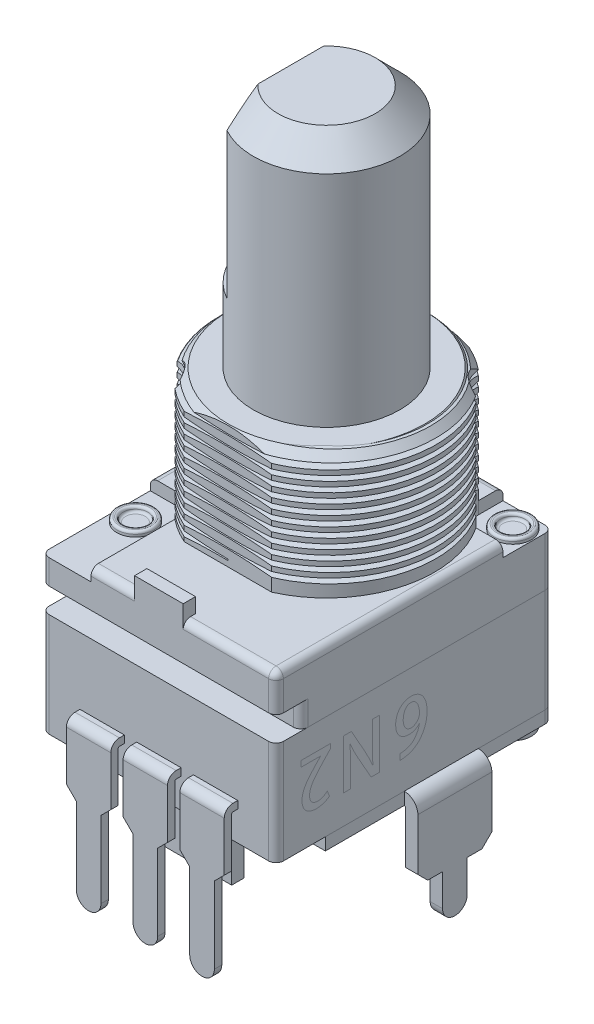
from build123d import *

# Parameters (mm, degrees)
SKETCH1_W               = 9.5
SKETCH1_H               = 11.2
BOSS_EXTRUDE1_DEPTH     = 7.2
SKETCH2_R               = 4.375
BOSS_EXTRUDE2_DEPTH     = 5
SKETCH3_R               = 2.97
BOSS_EXTRUDE3_DEPTH     = 9.9
CHAMFER1_SIZE           = 1
CUT_EXTRUDE1_START      = -6.9
CUT_EXTRUDE1_DEPTH      = 6.9
SKETCH5_W               = 1.8
SKETCH5_H               = 0.3
BOSS_EXTRUDE5_DEPTH     = 0.2
SKETCH7_W               = 1.8
SKETCH7_H               = 0.3
SKETCH8_W               = 1.8
SKETCH8_H               = 0.3
BOSS_EXTRUDE6_DEPTH     = 2
SKETCH9_W               = 1
SKETCH9_H               = 0.3
BOSS_EXTRUDE7_DEPTH     = 4
SKETCH10_W              = 3
SKETCH10_H              = 0.5
SKETCH12_W              = 0.5
SKETCH12_H              = 3
BOSS_EXTRUDE8_DEPTH     = 2.5
SKETCH14_W              = 0.5
SKETCH14_H              = 1
BOSS_EXTRUDE9_DEPTH     = 1.8
SKETCH15_W              = 3
SKETCH15_H              = 0.5
FILLET1_R               = 0.5
CHAMFER2_SIZE           = 0.4
SKETCH17_W              = 3
SKETCH17_H              = 0.5
BOSS_EXTRUDE10_DEPTH    = 2.5
SKETCH18_W              = 9.5
SKETCH18_H              = 0.5
CUT_EXTRUDE2_DEPTH      = 2
SKETCH20_W              = 9.5
SKETCH20_H              = 1
CUT_EXTRUDE3_DEPTH      = 1
SKETCH22_W              = 1.97
SKETCH22_H              = 0.5
BOSS_EXTRUDE11_DEPTH    = 0.6
CHAMFER4_SIZE           = 0.4
CUT_EXTRUDE4_DEPTH      = 17.968279229
CUT_EXTRUDE4_DEPTH_BACK = 0.5
SKETCH24_W              = 9.5
SKETCH24_H              = 0.4
CUT_EXTRUDE5_DEPTH      = 17.968279229
SKETCH25_R              = 0.75
SKETCH25_R_2            = 0.5
BOSS_EXTRUDE12_DEPTH    = 0.2
FILLET2_R               = 0.1
BOSS_EXTRUDE13_START    = 0.2
SKETCH27_R              = 0.75
BOSS_EXTRUDE13_DEPTH    = 0.2
FILLET3_R               = 0.3
CUT_SWEEP9_PITCH        = 0.4


with BuildPart() as part:
    # Sketch1 → Boss-Extrude1 (new body)
    with BuildSketch(Plane(origin=(0, 0, 0), x_dir=(1, 0, 0), z_dir=(0, 1, 0))):
        Rectangle(SKETCH1_W, SKETCH1_H)
    extrude(amount=BOSS_EXTRUDE1_DEPTH)

    # Sketch2 → Boss-Extrude2 (add)
    with BuildSketch(Plane(origin=(0, 7.2, 0), x_dir=(1, 0, 0), z_dir=(0, 1, 0))):
        with Locations(Location((0, 1.2, 0), (0, 0, 270))):
            Circle(SKETCH2_R)
    extrude(amount=BOSS_EXTRUDE2_DEPTH)

    # Sketch3 → Boss-Extrude3 (add)
    with BuildSketch(Plane(origin=(0, 12.2, 0), x_dir=(1, 0, 0), z_dir=(0, 1, 0))):
        with Locations(Location((0, 1.2, 0), (0, 0, 90))):
            Circle(SKETCH3_R)
    extrude(amount=BOSS_EXTRUDE3_DEPTH)

    # Chamfer1
    chamfer1_edges = [part.edges().sort_by_distance(p)[0] for p in [
        (0, 22.1, 1.77),
    ]]
    chamfer(chamfer1_edges, length=CHAMFER1_SIZE)

    # Sketch4 → Cut-Extrude1 (cut)
    with BuildSketch(Plane(origin=(0, 22.1, 0), x_dir=(1, 0, 0), z_dir=(0, 1, 0)).offset(CUT_EXTRUDE1_START)):
        with BuildLine():
            Line((-1.45, 3.791987654), (-1.45, -1.391987654))
            ThreePointArc((-1.45, -1.391987654), (-2.97, 1.2), (-1.45, 3.791987654))
        make_face()
    extrude(amount=CUT_EXTRUDE1_DEPTH, mode=Mode.SUBTRACT)

    # Sketch5 → Boss-Extrude5 (add)
    with BuildSketch(Plane.XY.offset(5.6)):
        with Locations((-2.3, 1.85)):
            Rectangle(SKETCH5_W, SKETCH5_H)
        with Locations((0, 1.85)):
            Rectangle(SKETCH5_W, SKETCH5_H)
        with Locations((2.3, 1.85)):
            Rectangle(SKETCH5_W, SKETCH5_H)
    extrude(amount=BOSS_EXTRUDE5_DEPTH)

    # Sweep1: sweep along a path in Sketch6
    with BuildLine(Plane(origin=(0, 0, 0), x_dir=(0, 0, -1), z_dir=(1, 0, 0))) as sweep1_path:
        ThreePointArc((-5.8, 1.7), (-5.835355339, 1.685355339), (-5.85, 1.65))
    # Sketch7 → Sweep1 (sweep)
    with BuildSketch(Plane.XY.offset(5.8)):
        with Locations((-2.3, 1.85)):
            Rectangle(SKETCH7_W, SKETCH7_H)
        with Locations((0, 1.85)):
            Rectangle(SKETCH7_W, SKETCH7_H)
        with Locations((2.3, 1.85)):
            Rectangle(SKETCH7_W, SKETCH7_H)
    sweep(path=sweep1_path.line)

    # Sketch8 → Boss-Extrude6 (add)
    with BuildSketch(Plane.XZ.offset(-1.65)):
        with Locations((-2.3, 6)):
            Rectangle(SKETCH8_W, SKETCH8_H)
        with Locations((0, 6)):
            Rectangle(SKETCH8_W, SKETCH8_H)
        with Locations((2.3, 6)):
            Rectangle(SKETCH8_W, SKETCH8_H)
    extrude(amount=BOSS_EXTRUDE6_DEPTH)

    # Sketch9 → Boss-Extrude7 (add)
    with BuildSketch(Plane.XZ.offset(0.35)):
        with Locations((-2.3, 6)):
            Rectangle(SKETCH9_W, SKETCH9_H)
        with Locations((0, 6)):
            Rectangle(SKETCH9_W, SKETCH9_H)
        with Locations((2.3, 6)):
            Rectangle(SKETCH9_W, SKETCH9_H)
    extrude(amount=BOSS_EXTRUDE7_DEPTH)

    # Sweep2: sweep along a path in Sketch11
    with BuildLine(Plane.XY) as sweep2_path:
        ThreePointArc((-4.75, 0), (-4.785355339, -0.014644661), (-4.8, -0.05))
    # Sketch10 → Sweep2 (sweep)
    with BuildSketch(Plane.ZY.offset(4.75)):
        with Locations((-1.1, 0.25)):
            Rectangle(SKETCH10_W, SKETCH10_H)
    sweep2 = sweep(path=sweep2_path.line)

    # Sketch12 → Boss-Extrude8 (add)
    with BuildSketch(Plane.XZ.offset(0.05)):
        with Locations((-5.05, -1.1)):
            Rectangle(SKETCH12_W, SKETCH12_H)
    boss_extrude8 = extrude(amount=BOSS_EXTRUDE8_DEPTH)

    # Sketch14 → Boss-Extrude9 (add)
    with BuildSketch(Plane.XZ.offset(2.55)):
        with Locations((-5.05, -1.1)):
            Rectangle(SKETCH14_W, SKETCH14_H)
    boss_extrude9 = extrude(amount=BOSS_EXTRUDE9_DEPTH)

    # Mirror1: Sweep2, Boss-Extrude8, Boss-Extrude9 across plane
    add(sweep2.mirror(Plane(origin=(0, 0, 0), x_dir=(0, 0, 1), z_dir=(1, 0, 0))))
    add(boss_extrude8.mirror(Plane(origin=(0, 0, 0), x_dir=(0, 0, 1), z_dir=(1, 0, 0))))
    add(boss_extrude9.mirror(Plane(origin=(0, 0, 0), x_dir=(0, 0, 1), z_dir=(1, 0, 0))))

    # Sweep3: sweep along a path in Sketch16
    with BuildLine(Plane(origin=(0, 0, 0), x_dir=(0, 0, -1), z_dir=(1, 0, 0))) as sweep3_path:
        ThreePointArc((5.65, -0.05), (5.635355339, -0.014644661), (5.6, 0))
    # Sketch15 → Sweep3 (sweep)
    with BuildSketch(Plane(origin=(0, 0, -5.6), x_dir=(-1, 0, 0), z_dir=(0, 0, -1))):
        with Locations((0, 0.25)):
            Rectangle(SKETCH15_W, SKETCH15_H)
    sweep3 = sweep(path=sweep3_path.line)

    # Fillet1
    fillet1_edges = [part.edges().sort_by_distance(p)[0] for p in [
        (2.8, -4.35, 6),
        (1.8, -4.35, 6),
        (0.5, -4.35, 6),
        (-0.5, -4.35, 6),
        (-1.8, -4.35, 6),
        (-2.8, -4.35, 6),
        (-5.05, -4.35, -0.6),
        (-5.05, -4.35, -1.6),
        (5.05, -4.35, -0.6),
        (5.05, -4.35, -1.6),
    ]]
    fillet(fillet1_edges, radius=FILLET1_R - 0.0001)  # a hair under: the kernel refuses the full size

    # Chamfer2
    chamfer2_edges = [part.edges().sort_by_distance(p)[0] for p in [
        (1.8, -0.35, 6),
        (2.8, -0.35, 6),
        (0.5, -0.35, 6),
        (-0.5, -0.35, 6),
        (-1.8, -0.35, 6),
        (-2.8, -0.35, 6),
        (-5.05, -2.55, 0.4),
        (-5.05, -2.55, -2.6),
        (5.05, -2.55, -2.6),
        (5.05, -2.55, 0.4),
    ]]
    chamfer(chamfer2_edges, length=CHAMFER2_SIZE - 0.0001)  # a hair under: the kernel refuses the full size

    # Sketch17 → Boss-Extrude10 (add)
    with BuildSketch(Plane.XZ.offset(0.05)):
        with Locations((0, -5.9)):
            Rectangle(SKETCH17_W, SKETCH17_H)
    boss_extrude10 = extrude(amount=BOSS_EXTRUDE10_DEPTH)

    # Sketch18 → Cut-Extrude2 (cut)
    with BuildSketch(Plane.XY.offset(5.6)):
        with Locations((0, 0.25)):
            Rectangle(SKETCH18_W, SKETCH18_H)
    extrude(amount=-CUT_EXTRUDE2_DEPTH, mode=Mode.SUBTRACT)

    # Mirror2: Sweep3, Boss-Extrude10 across plane
    add(sweep3.mirror(Plane.XY.offset(-1)))
    add(boss_extrude10.mirror(Plane.XY.offset(-1)))

    # Sketch20 → Cut-Extrude3 (cut)
    with BuildSketch(Plane.XY.offset(5.6)):
        with Locations((0, 5.2)):
            Rectangle(SKETCH20_W, SKETCH20_H)
    extrude(amount=-CUT_EXTRUDE3_DEPTH, mode=Mode.SUBTRACT)

    # Sketch22 → Boss-Extrude11 (add)
    with BuildSketch(Plane(origin=(0, 7.2, 0), x_dir=(1, 0, 0), z_dir=(0, 1, 0))):
        with Locations((0, -5.35)):
            Rectangle(SKETCH22_W, SKETCH22_H)
    extrude(amount=BOSS_EXTRUDE11_DEPTH)

    # Chamfer4
    chamfer4_edges = [part.edges().sort_by_distance(p)[0] for p in [
        (0, 12.2, -5.575),
    ]]
    chamfer(chamfer4_edges, length=CHAMFER4_SIZE)

    # Sketch23 → Cut-Extrude4 (cut, two sides: drawn at the far end of the back side and taken through both)
    with BuildSketch(Plane(origin=(0, 7.2, 0), x_dir=(1, 0, 0), z_dir=(0, 1, 0)).offset(-CUT_EXTRUDE4_DEPTH_BACK)):
        with BuildLine():
            Line((4.75, 5.6), (2.75, 5.6))
            Line((2.75, 5.6), (2.75, 4.6))
            ThreePointArc((2.75, 4.6), (3.042893219, 3.892893219), (3.75, 3.6))
            Line((3.75, 3.6), (4.75, 3.6))
            Line((4.75, 3.6), (4.75, 5.6))
        make_face()
        with BuildLine():
            Line((-4.75, -5.6), (-2.75, -5.6))
            Line((-2.75, -5.6), (-2.75, -2.2))
            ThreePointArc((-2.75, -2.2), (-3.042893219, -1.492893219), (-3.75, -1.2))
            Line((-3.75, -1.2), (-4.75, -1.2))
            Line((-4.75, -1.2), (-4.75, -5.6))
        make_face()
    extrude(amount=CUT_EXTRUDE4_DEPTH + CUT_EXTRUDE4_DEPTH_BACK, mode=Mode.SUBTRACT)

    # Sketch24 → Cut-Extrude5 (cut, through all)
    with BuildSketch(Plane(origin=(0, 7.2, 0), x_dir=(1, 0, 0), z_dir=(0, 1, 0))):
        with Locations((0, 5.4)):
            Rectangle(SKETCH24_W, SKETCH24_H)
        with Locations((0, -3)):
            Rectangle(SKETCH24_W, SKETCH24_H)
    extrude(amount=CUT_EXTRUDE5_DEPTH, mode=Mode.SUBTRACT)

    # Sketch25 → Boss-Extrude12 (add)
    # profile 1 of 2: a face of its own
    with BuildSketch(Plane(origin=(0, 6.7, 0), x_dir=(1, 0, 0), z_dir=(0, 1, 0))):
        with Locations(Location((3.95, 4.8, 0), (0, 0, 90))):
            Circle(SKETCH25_R)
        with Locations(Location((3.95, 4.8, 0), (0, 0, 270))):
            Circle(SKETCH25_R_2, mode=Mode.SUBTRACT)
    # profile 2 of 2: a face of its own
    with BuildSketch(Plane(origin=(0, 6.7, 0), x_dir=(1, 0, 0), z_dir=(0, 1, 0))):
        with Locations(Location((-3.95, -2.6, 0), (0, 0, 90))):
            Circle(SKETCH25_R)
        with Locations(Location((-3.95, -2.6, 0), (0, 0, 270))):
            Circle(SKETCH25_R_2, mode=Mode.SUBTRACT)
    extrude(amount=BOSS_EXTRUDE12_DEPTH)

    # Fillet2
    fillet2_edges = [part.edges().sort_by_distance(p)[0] for p in [
        (3.95, 6.9, -4.05),
        (3.95, 6.7, -5.3),
        (3.95, 6.9, -5.3),
        (-3.95, 6.9, 3.35),
        (-3.95, 6.7, 2.1),
        (-3.95, 6.9, 2.1),
    ]]
    fillet(fillet2_edges, radius=FILLET2_R - 0.0001)  # a hair under: the kernel refuses the full size

    # Sketch27 → Boss-Extrude13 (add)
    with BuildSketch(Plane.XZ.offset(BOSS_EXTRUDE13_START)):
        with Locations(Location((-3.95, 2.6, 0), (0, 0, 270))):
            Circle(SKETCH27_R)
        with Locations(Location((3.95, -4.8, 0), (0, 0, 270))):
            Circle(SKETCH27_R)
    extrude(amount=-BOSS_EXTRUDE13_DEPTH)

    # Fillet3
    fillet3_edges = [part.edges().sort_by_distance(p)[0] for p in [
        (4.75, 7.2, 1),
        (-4.75, 7.2, -2.2),
        (4.75, 3.35, -5.6),
        (-4.75, 3.6, -5.6),
        (4.75, 2.6, 5.6),
        (-4.75, 2.6, 5.6),
        (-4.75, 5.2, 4.6),
        (4.75, 5.2, 4.6),
        (4.75, 3.35, -5.6),
        (-4.75, 3.6, -5.6),
        (2.8675, 7.2, 5.6),
        (4.75, 3.35, -5.6),
        (-1, 7.2, -5.6),
        (-4.75, 6.2, 5.6),
        (-1.8675, 7.2, 5.6),
        (-4.75, 3.6, -5.6),
        (4.75, 6.45, 5.6),
    ]]
    fillet(fillet3_edges, radius=FILLET3_R)

    # Cut-Sweep9: arcs per turn and ends read off the stored shape
    # Cut-Sweep9: the profile of Sketch35 screwed along a left-hand helix through 14 turns, 6 arcs to a turn; built about Z, then put on its axis
    cut_sweep9_z = Axis((0, 0, 0), (0, 0, 1))
    cut_sweep9_corners = [(3.875, 0, 0), (4.975, 0, 0.225), (4.975, 0, -0.225)]
    with BuildLine(mode=Mode.PRIVATE) as cut_sweep9_profile:
        Line(cut_sweep9_corners[0], cut_sweep9_corners[1])
        Line(cut_sweep9_corners[1], cut_sweep9_corners[2])
        Line(cut_sweep9_corners[2], cut_sweep9_corners[0])
    cut_sweep9_cap = Face(cut_sweep9_profile.wire())
    cut_sweep9_turn_angles = [0, -30, -60, -90, -120, -150, -180, -210, -240, -270, -300, -330, -360]
    cut_sweep9_turn_weights = [1, 0.8660254037844387, 1, 0.8660254037844387, 1, 0.8660254037844387, 1, 0.8660254037844387, 1, 0.8660254037844387, 1, 0.8660254037844387, 1]
    cut_sweep9_turn_rails = [Edge.make_bspline([Vector(p[0], p[1], 0).rotate(cut_sweep9_z, cut_sweep9_turn_angles[k]) / cut_sweep9_turn_weights[k] + Vector(0, 0, p[2] + -CUT_SWEEP9_PITCH * cut_sweep9_turn_angles[k] / 360) for k in range(13)], [0, 0, 0, 1, 1, 2, 2, 3, 3, 4, 4, 5, 5, 6, 6, 6], 2, cut_sweep9_turn_weights) for p in cut_sweep9_corners]
    cut_sweep9_turn_sides = [Face.make_surface_from_curves(cut_sweep9_turn_rails[p[0]], cut_sweep9_turn_rails[p[1]]) for p in [(0, 1), (1, 2), (2, 0)]]
    cut_sweep9 = Plane(origin=(0, 7.45, -1.2), x_dir=(0, 0, 1), z_dir=(0, 1, 0)) * Solid(Shell([*[p.moved(Location((0, 0, CUT_SWEEP9_PITCH * i))) for i in range(14) for p in cut_sweep9_turn_sides], cut_sweep9_cap, cut_sweep9_cap.rotate(cut_sweep9_z, -5040).moved(Location((0, 0, -CUT_SWEEP9_PITCH * -5040 / 360)))]))
    add(cut_sweep9, mode=Mode.SUBTRACT)


solid = part.part
